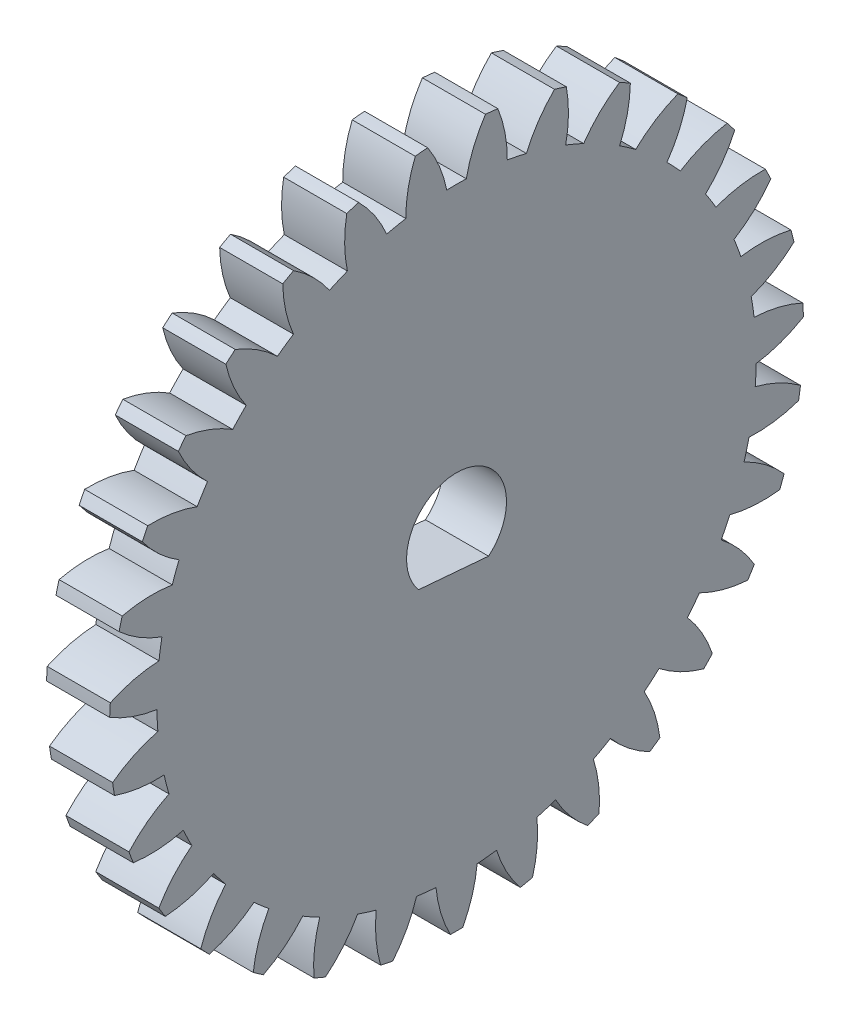
from build123d import *

# Parameters (mm, degrees)
BASPROSKE_W     = 2
BASPROSKE_H     = 16.5
TOOTHCUT_DEPTH  = 24.420076857
TEETHCUTS_COUNT = 31
TEETHCUTS_ANGLE = 348.387096774
BORE_DEPTH      = 50.0000508
SCALE1_SCALE_X  = 1.5
SCALE1_SCALE_Y  = 1
SCALE1_SCALE_Z  = 1


with BuildPart() as part:
    # BasProSke → Base-Revolve (revolve)
    with BuildSketch(Plane(origin=(0, 0, 0), x_dir=(1, 0, 0), z_dir=(0, 1, 0))):
        with Locations((1, 8.25)):
            Rectangle(BASPROSKE_W, BASPROSKE_H)
    revolve(axis=Axis((-10, 0, 0), (1, 0, 0)))

    # TooCutSke → ToothCut (cut, through all)
    with BuildSketch(Plane(origin=(0, 0, 0), x_dir=(0, 0, -1), z_dir=(1, 0, 0))):
        with BuildLine():
            ThreePointArc((0.464153838, 14.241438207), (0, 14.249), (-0.464153838, 14.241438207))
            ThreePointArc((-0.464153838, 14.241438207), (-0.818831014, 15.399587018), (-1.391915479, 16.466675938))
            ThreePointArc((-1.391915479, 16.466675938), (0, 16.5254), (1.391915479, 16.466675938))
            ThreePointArc((1.391915479, 16.466675938), (0.818831014, 15.399587018), (0.464153838, 14.241438207))
        make_face()
    toothcut = extrude(amount=TOOTHCUT_DEPTH, mode=Mode.SUBTRACT)

    # TeethCuts: ToothCut ×31 about axis
    teethcuts_axis = Axis((-10, 0, 0), (1, 0, 0))
    for i in range(1, TEETHCUTS_COUNT):
        add(toothcut.rotate(teethcuts_axis, i * TEETHCUTS_ANGLE / (TEETHCUTS_COUNT - 1)), mode=Mode.SUBTRACT)

    # BorSke → Bore (cut, symmetric)
    with BuildSketch(Plane(origin=(0, 0, 0), x_dir=(0, 0, -1), z_dir=(1, 0, 0))):
        with BuildLine():
            Line((-1.806034106, -1.542342596), (1.521051715, -1.824001523))
            ThreePointArc((1.521051715, -1.824001523), (0.200341405, 2.366525554), (-1.806034106, -1.542342596))
        make_face()
    extrude(amount=BORE_DEPTH, both=True, mode=Mode.SUBTRACT)


with BuildPart() as part_1:
    # Scale1: scaled about (1, -0.00428201, 0.000362499)
    add(part.part.scale((SCALE1_SCALE_X, SCALE1_SCALE_Y, SCALE1_SCALE_Z), about=(1, -0.00428201, 0.000362499)))


solid = part_1.part
